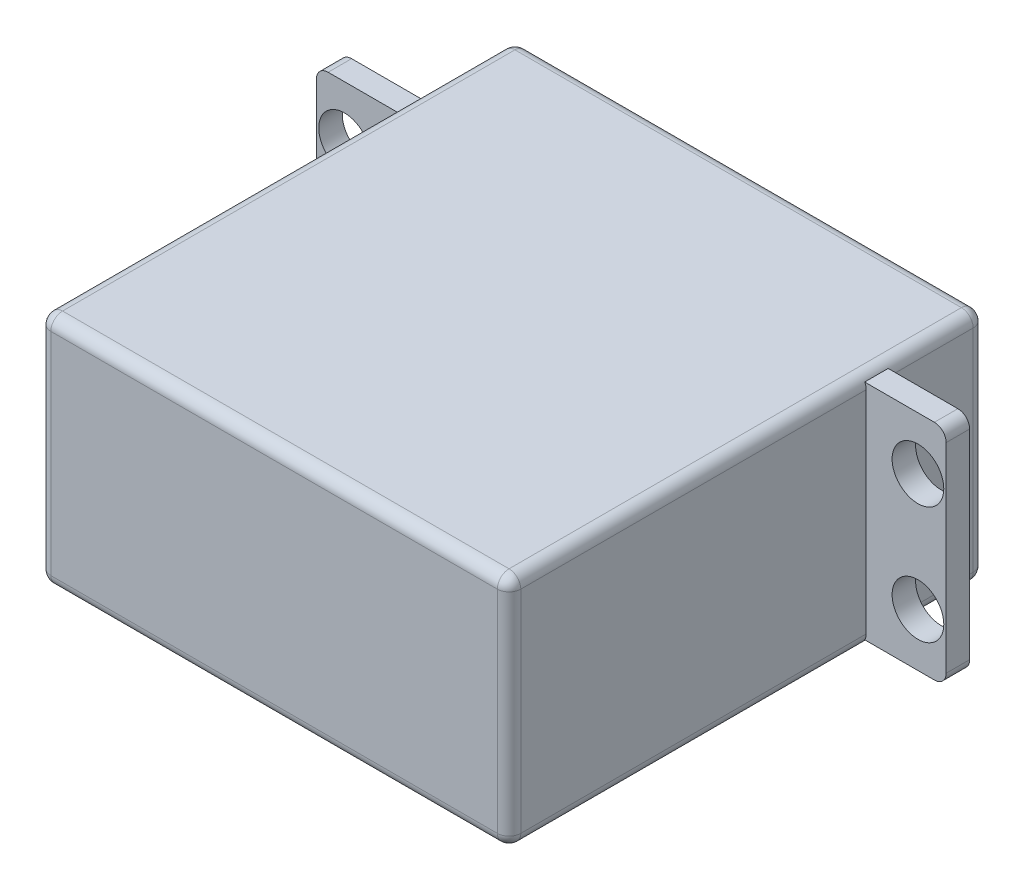
from build123d import *

# Parameters (mm, degrees)
SKETCH1_W           = 40
SKETCH1_H           = 20
BOSS_EXTRUDE1_DEPTH = 40.5
SKETCH2_W           = 53.6
SKETCH2_H           = 19
BOSS_EXTRUDE2_DEPTH = 2
SKETCH3_R           = 2.2
CUT_EXTRUDE1_DEPTH  = 2
SKETCH4_R           = 3
SKETCH4_R_2         = 1
BOSS_EXTRUDE3_DEPTH = 4
FILLET1_R           = 1
FILLET2_R           = 1


with BuildPart() as part:
    # Sketch1 → Boss-Extrude1 (new body)
    with BuildSketch(Plane.XY):
        Rectangle(SKETCH1_W, SKETCH1_H)
    extrude(amount=BOSS_EXTRUDE1_DEPTH)

    # Sketch2 → Boss-Extrude2 (add)
    with BuildSketch(Plane.XY.offset(10.1)):
        Rectangle(SKETCH2_W, SKETCH2_H)
    extrude(amount=-BOSS_EXTRUDE2_DEPTH)

    # Sketch3 → Cut-Extrude1 (cut)
    with BuildSketch(Plane.XY.offset(10.1)):
        with Locations((-24.4, 5)):
            Circle(SKETCH3_R)
        with Locations((-24.4, -5)):
            Circle(SKETCH3_R)
        with Locations((24.4, 5)):
            Circle(SKETCH3_R)
        with Locations((24.4, -5)):
            Circle(SKETCH3_R)
    extrude(amount=-CUT_EXTRUDE1_DEPTH, mode=Mode.SUBTRACT)

    # Sketch4 → Boss-Extrude3 (add)
    with BuildSketch(Plane(origin=(0, 0, 0), x_dir=(-1, 0, 0), z_dir=(0, 0, -1))):
        with Locations((10, 0)):
            Circle(SKETCH4_R)
        with Locations((10, 0)):
            Circle(SKETCH4_R_2, mode=Mode.SUBTRACT)
    extrude(amount=BOSS_EXTRUDE3_DEPTH)

    # Fillet1
    # the kernel refuses this fillet: 1 mm, written as the material it takes off along each edge
    with BuildSketch(Plane(origin=(-26.8, -9.5, 12.6), x_dir=(1, 0, 0), z_dir=(0, 0, -1)), Plane(origin=(26.8, 9.5, 12.6), x_dir=(-1, 0, 0), z_dir=(0, 0, -1))) as fillet1_piece_1:
        with BuildLine():
            CenterArc((FILLET1_R, -FILLET1_R), FILLET1_R, 90, 90)
            Line((0, -FILLET1_R), (0, 0))
            Line((0, 0), (FILLET1_R, 0))
        make_face()
    extrude(amount=7, mode=Mode.SUBTRACT)
    with BuildSketch(Plane(origin=(-26.8, 9.5, 12.6), x_dir=(1, 0, 0), z_dir=(0, 0, -1)), Plane(origin=(26.8, -9.5, 12.6), x_dir=(-1, 0, 0), z_dir=(0, 0, -1))) as fillet1_piece_2:
        with BuildLine():
            CenterArc((FILLET1_R, FILLET1_R), FILLET1_R, 180, 90)
            Line((0, FILLET1_R), (0, 0))
            Line((0, 0), (FILLET1_R, 0))
        make_face()
    extrude(amount=7, mode=Mode.SUBTRACT)
    with BuildSketch(Plane(origin=(-20, 10, -2.5), x_dir=(0, -1, 0), z_dir=(0, 0, 1))) as fillet1_piece_3_section:
        with BuildLine():
            CenterArc((FILLET1_R, FILLET1_R), FILLET1_R, 180, 90)
            Line((0, FILLET1_R), (0, 0))
            Line((0, 0), (FILLET1_R, 0))
        make_face()
    fillet1_piece_3 = extrude(amount=45.5, mode=Mode.PRIVATE)
    fillet1_piece_3 = split(fillet1_piece_3, bisect_by=Plane(origin=(-19.975991618, 9.336749215, 8.1), z_dir=(0, 0, -1)), keep=Keep.TOP, mode=Mode.PRIVATE)
    fillet1_piece_3 = split(fillet1_piece_3, bisect_by=Plane(origin=(-19.975991618, 9.5, 2.8), z_dir=(0, -1, 0)), keep=Keep.TOP, mode=Mode.PRIVATE)
    add(fillet1_piece_3, mode=Mode.SUBTRACT)
    with BuildSketch(Plane(origin=(-20, 10, -2.5), x_dir=(0, -1, 0), z_dir=(0, 0, 1))) as fillet1_piece_4_section:
        with BuildLine():
            CenterArc((FILLET1_R, FILLET1_R), FILLET1_R, 180, 90)
            Line((0, FILLET1_R), (0, 0))
            Line((0, 0), (FILLET1_R, 0))
        make_face()
    fillet1_piece_4 = extrude(amount=45.5, mode=Mode.PRIVATE)
    fillet1_piece_4 = split(fillet1_piece_4, bisect_by=Plane(origin=(-19.74487994, 9.835608236, 8.1), z_dir=(0, 0, -1)), keep=Keep.TOP, mode=Mode.PRIVATE)
    fillet1_piece_4 = split(fillet1_piece_4, bisect_by=Plane(origin=(-19.74487994, 9.5, 2.8), z_dir=(0, 1, 0)), keep=Keep.TOP, mode=Mode.PRIVATE)
    add(fillet1_piece_4, mode=Mode.SUBTRACT)
    with BuildSketch(Plane(origin=(-20, 10, -2.5), x_dir=(0, -1, 0), z_dir=(0, 0, 1))) as fillet1_piece_5_section:
        with BuildLine():
            CenterArc((FILLET1_R, FILLET1_R), FILLET1_R, 180, 90)
            Line((0, FILLET1_R), (0, 0))
            Line((0, 0), (FILLET1_R, 0))
        make_face()
    fillet1_piece_5 = extrude(amount=45.5, mode=Mode.PRIVATE)
    fillet1_piece_5 = split(fillet1_piece_5, bisect_by=Plane(origin=(-19.74487994, 9.835608236, 8.1), z_dir=(0, 0, 1)), keep=Keep.TOP, mode=Mode.PRIVATE)
    fillet1_piece_5 = split(fillet1_piece_5, bisect_by=Plane(origin=(-19.74487994, 9.5, 9.1), z_dir=(0, 1, 0)), keep=Keep.TOP, mode=Mode.PRIVATE)
    fillet1_piece_5 = split(fillet1_piece_5, bisect_by=Plane(origin=(-19.74487994, 9.835608236, 10.1), z_dir=(0, 0, -1)), keep=Keep.TOP, mode=Mode.PRIVATE)
    add(fillet1_piece_5, mode=Mode.SUBTRACT)
    with BuildSketch(Plane(origin=(-20, 10, -2.5), x_dir=(0, -1, 0), z_dir=(0, 0, 1))) as fillet1_piece_6_section:
        with BuildLine():
            CenterArc((FILLET1_R, FILLET1_R), FILLET1_R, 180, 90)
            Line((0, FILLET1_R), (0, 0))
            Line((0, 0), (FILLET1_R, 0))
        make_face()
    fillet1_piece_6 = extrude(amount=45.5, mode=Mode.PRIVATE)
    fillet1_piece_6 = split(fillet1_piece_6, bisect_by=Plane(origin=(-19.975991618, 9.5, 26.55), z_dir=(0, -1, 0)), keep=Keep.TOP, mode=Mode.PRIVATE)
    fillet1_piece_6 = split(fillet1_piece_6, bisect_by=Plane(origin=(-19.975991618, 9.336749215, 10.1), z_dir=(0, 0, 1)), keep=Keep.TOP, mode=Mode.PRIVATE)
    add(fillet1_piece_6, mode=Mode.SUBTRACT)
    with BuildSketch(Plane(origin=(-20, 10, -2.5), x_dir=(0, -1, 0), z_dir=(0, 0, 1))) as fillet1_piece_7_section:
        with BuildLine():
            CenterArc((FILLET1_R, FILLET1_R), FILLET1_R, 180, 90)
            Line((0, FILLET1_R), (0, 0))
            Line((0, 0), (FILLET1_R, 0))
        make_face()
    fillet1_piece_7 = extrude(amount=45.5, mode=Mode.PRIVATE)
    fillet1_piece_7 = split(fillet1_piece_7, bisect_by=Plane(origin=(-19.74487994, 9.5, 26.55), z_dir=(0, 1, 0)), keep=Keep.TOP, mode=Mode.PRIVATE)
    fillet1_piece_7 = split(fillet1_piece_7, bisect_by=Plane(origin=(-19.74487994, 9.835608236, 10.1), z_dir=(0, 0, 1)), keep=Keep.TOP, mode=Mode.PRIVATE)
    add(fillet1_piece_7, mode=Mode.SUBTRACT)
    with BuildSketch(Plane(origin=(20, 10, -2.5), x_dir=(0, -1, 0), z_dir=(0, 0, 1))) as fillet1_piece_8_section:
        with BuildLine():
            CenterArc((FILLET1_R, -FILLET1_R), FILLET1_R, 90, 90)
            Line((0, -FILLET1_R), (0, 0))
            Line((0, 0), (FILLET1_R, 0))
        make_face()
    fillet1_piece_8 = extrude(amount=45.5, mode=Mode.PRIVATE)
    fillet1_piece_8 = split(fillet1_piece_8, bisect_by=Plane(origin=(19.975991618, 9.5, 2.8), z_dir=(0, -1, 0)), keep=Keep.TOP, mode=Mode.PRIVATE)
    fillet1_piece_8 = split(fillet1_piece_8, bisect_by=Plane(origin=(19.975991618, 9.336749215, 8.1), z_dir=(0, 0, -1)), keep=Keep.TOP, mode=Mode.PRIVATE)
    add(fillet1_piece_8, mode=Mode.SUBTRACT)
    with BuildSketch(Plane(origin=(20, 10, -2.5), x_dir=(0, -1, 0), z_dir=(0, 0, 1))) as fillet1_piece_9_section:
        with BuildLine():
            CenterArc((FILLET1_R, -FILLET1_R), FILLET1_R, 90, 90)
            Line((0, -FILLET1_R), (0, 0))
            Line((0, 0), (FILLET1_R, 0))
        make_face()
    fillet1_piece_9 = extrude(amount=45.5, mode=Mode.PRIVATE)
    fillet1_piece_9 = split(fillet1_piece_9, bisect_by=Plane(origin=(19.74487994, 9.5, 2.8), z_dir=(0, 1, 0)), keep=Keep.TOP, mode=Mode.PRIVATE)
    fillet1_piece_9 = split(fillet1_piece_9, bisect_by=Plane(origin=(19.74487994, 9.835608236, 8.1), z_dir=(0, 0, -1)), keep=Keep.TOP, mode=Mode.PRIVATE)
    add(fillet1_piece_9, mode=Mode.SUBTRACT)
    with BuildSketch(Plane(origin=(20, 10, -2.5), x_dir=(0, -1, 0), z_dir=(0, 0, 1))) as fillet1_piece_10_section:
        with BuildLine():
            CenterArc((FILLET1_R, -FILLET1_R), FILLET1_R, 90, 90)
            Line((0, -FILLET1_R), (0, 0))
            Line((0, 0), (FILLET1_R, 0))
        make_face()
    fillet1_piece_10 = extrude(amount=45.5, mode=Mode.PRIVATE)
    fillet1_piece_10 = split(fillet1_piece_10, bisect_by=Plane(origin=(19.74487994, 9.835608236, 10.1), z_dir=(0, 0, -1)), keep=Keep.TOP, mode=Mode.PRIVATE)
    fillet1_piece_10 = split(fillet1_piece_10, bisect_by=Plane(origin=(19.74487994, 9.5, 9.1), z_dir=(0, 1, 0)), keep=Keep.TOP, mode=Mode.PRIVATE)
    fillet1_piece_10 = split(fillet1_piece_10, bisect_by=Plane(origin=(19.74487994, 9.835608236, 8.1), z_dir=(0, 0, 1)), keep=Keep.TOP, mode=Mode.PRIVATE)
    add(fillet1_piece_10, mode=Mode.SUBTRACT)
    with BuildSketch(Plane(origin=(20, 10, -2.5), x_dir=(0, -1, 0), z_dir=(0, 0, 1))) as fillet1_piece_11_section:
        with BuildLine():
            CenterArc((FILLET1_R, -FILLET1_R), FILLET1_R, 90, 90)
            Line((0, -FILLET1_R), (0, 0))
            Line((0, 0), (FILLET1_R, 0))
        make_face()
    fillet1_piece_11 = extrude(amount=45.5, mode=Mode.PRIVATE)
    fillet1_piece_11 = split(fillet1_piece_11, bisect_by=Plane(origin=(19.975991618, 9.336749215, 10.1), z_dir=(0, 0, 1)), keep=Keep.TOP, mode=Mode.PRIVATE)
    fillet1_piece_11 = split(fillet1_piece_11, bisect_by=Plane(origin=(19.975991618, 9.5, 26.55), z_dir=(0, -1, 0)), keep=Keep.TOP, mode=Mode.PRIVATE)
    add(fillet1_piece_11, mode=Mode.SUBTRACT)
    with BuildSketch(Plane(origin=(20, 10, -2.5), x_dir=(0, -1, 0), z_dir=(0, 0, 1))) as fillet1_piece_12_section:
        with BuildLine():
            CenterArc((FILLET1_R, -FILLET1_R), FILLET1_R, 90, 90)
            Line((0, -FILLET1_R), (0, 0))
            Line((0, 0), (FILLET1_R, 0))
        make_face()
    fillet1_piece_12 = extrude(amount=45.5, mode=Mode.PRIVATE)
    fillet1_piece_12 = split(fillet1_piece_12, bisect_by=Plane(origin=(19.74487994, 9.835608236, 10.1), z_dir=(0, 0, 1)), keep=Keep.TOP, mode=Mode.PRIVATE)
    fillet1_piece_12 = split(fillet1_piece_12, bisect_by=Plane(origin=(19.74487994, 9.5, 26.55), z_dir=(0, 1, 0)), keep=Keep.TOP, mode=Mode.PRIVATE)
    add(fillet1_piece_12, mode=Mode.SUBTRACT)
    with BuildSketch(Plane(origin=(-20, -10, -2.5), x_dir=(1, 0, 0), z_dir=(0, 0, 1))) as fillet1_piece_13_section:
        with BuildLine():
            CenterArc((FILLET1_R, FILLET1_R), FILLET1_R, 180, 90)
            Line((0, FILLET1_R), (0, 0))
            Line((0, 0), (FILLET1_R, 0))
        make_face()
    fillet1_piece_13 = extrude(amount=45.5, mode=Mode.PRIVATE)
    fillet1_piece_13 = split(fillet1_piece_13, bisect_by=Plane(origin=(-19.74487994, -9.835608236, 8.1), z_dir=(0, 0, -1)), keep=Keep.TOP, mode=Mode.PRIVATE)
    fillet1_piece_13 = split(fillet1_piece_13, bisect_by=Plane(origin=(-19.74487994, -9.5, 2.8), z_dir=(0, -1, 0)), keep=Keep.TOP, mode=Mode.PRIVATE)
    add(fillet1_piece_13, mode=Mode.SUBTRACT)
    with BuildSketch(Plane(origin=(-20, -10, -2.5), x_dir=(1, 0, 0), z_dir=(0, 0, 1))) as fillet1_piece_14_section:
        with BuildLine():
            CenterArc((FILLET1_R, FILLET1_R), FILLET1_R, 180, 90)
            Line((0, FILLET1_R), (0, 0))
            Line((0, 0), (FILLET1_R, 0))
        make_face()
    fillet1_piece_14 = extrude(amount=45.5, mode=Mode.PRIVATE)
    fillet1_piece_14 = split(fillet1_piece_14, bisect_by=Plane(origin=(-19.975991618, -9.336749215, 8.1), z_dir=(0, 0, -1)), keep=Keep.TOP, mode=Mode.PRIVATE)
    fillet1_piece_14 = split(fillet1_piece_14, bisect_by=Plane(origin=(-19.975991618, -9.5, 2.8), z_dir=(0, 1, 0)), keep=Keep.TOP, mode=Mode.PRIVATE)
    add(fillet1_piece_14, mode=Mode.SUBTRACT)
    with BuildSketch(Plane(origin=(-20, -10, -2.5), x_dir=(1, 0, 0), z_dir=(0, 0, 1))) as fillet1_piece_15_section:
        with BuildLine():
            CenterArc((FILLET1_R, FILLET1_R), FILLET1_R, 180, 90)
            Line((0, FILLET1_R), (0, 0))
            Line((0, 0), (FILLET1_R, 0))
        make_face()
    fillet1_piece_15 = extrude(amount=45.5, mode=Mode.PRIVATE)
    fillet1_piece_15 = split(fillet1_piece_15, bisect_by=Plane(origin=(-19.74487994, -9.835608236, 8.1), z_dir=(0, 0, 1)), keep=Keep.TOP, mode=Mode.PRIVATE)
    fillet1_piece_15 = split(fillet1_piece_15, bisect_by=Plane(origin=(-19.74487994, -9.835608236, 10.1), z_dir=(0, 0, -1)), keep=Keep.TOP, mode=Mode.PRIVATE)
    fillet1_piece_15 = split(fillet1_piece_15, bisect_by=Plane(origin=(-19.74487994, -9.5, 9.1), z_dir=(0, -1, 0)), keep=Keep.TOP, mode=Mode.PRIVATE)
    add(fillet1_piece_15, mode=Mode.SUBTRACT)
    with BuildSketch(Plane(origin=(-20, -10, -2.5), x_dir=(1, 0, 0), z_dir=(0, 0, 1))) as fillet1_piece_16_section:
        with BuildLine():
            CenterArc((FILLET1_R, FILLET1_R), FILLET1_R, 180, 90)
            Line((0, FILLET1_R), (0, 0))
            Line((0, 0), (FILLET1_R, 0))
        make_face()
    fillet1_piece_16 = extrude(amount=45.5, mode=Mode.PRIVATE)
    fillet1_piece_16 = split(fillet1_piece_16, bisect_by=Plane(origin=(-19.74487994, -9.835608236, 10.1), z_dir=(0, 0, 1)), keep=Keep.TOP, mode=Mode.PRIVATE)
    fillet1_piece_16 = split(fillet1_piece_16, bisect_by=Plane(origin=(-19.74487994, -9.5, 26.55), z_dir=(0, -1, 0)), keep=Keep.TOP, mode=Mode.PRIVATE)
    add(fillet1_piece_16, mode=Mode.SUBTRACT)
    with BuildSketch(Plane(origin=(-20, -10, -2.5), x_dir=(1, 0, 0), z_dir=(0, 0, 1))) as fillet1_piece_17_section:
        with BuildLine():
            CenterArc((FILLET1_R, FILLET1_R), FILLET1_R, 180, 90)
            Line((0, FILLET1_R), (0, 0))
            Line((0, 0), (FILLET1_R, 0))
        make_face()
    fillet1_piece_17 = extrude(amount=45.5, mode=Mode.PRIVATE)
    fillet1_piece_17 = split(fillet1_piece_17, bisect_by=Plane(origin=(-19.975991618, -9.336749215, 10.1), z_dir=(0, 0, 1)), keep=Keep.TOP, mode=Mode.PRIVATE)
    fillet1_piece_17 = split(fillet1_piece_17, bisect_by=Plane(origin=(-19.975991618, -9.5, 26.55), z_dir=(0, 1, 0)), keep=Keep.TOP, mode=Mode.PRIVATE)
    add(fillet1_piece_17, mode=Mode.SUBTRACT)
    with BuildSketch(Plane(origin=(20, -10, -2.5), x_dir=(-1, 0, 0), z_dir=(0, 0, 1))) as fillet1_piece_18_section:
        with BuildLine():
            CenterArc((FILLET1_R, -FILLET1_R), FILLET1_R, 90, 90)
            Line((0, -FILLET1_R), (0, 0))
            Line((0, 0), (FILLET1_R, 0))
        make_face()
    fillet1_piece_18 = extrude(amount=45.5, mode=Mode.PRIVATE)
    fillet1_piece_18 = split(fillet1_piece_18, bisect_by=Plane(origin=(19.74487994, -9.835608236, 8.1), z_dir=(0, 0, -1)), keep=Keep.TOP, mode=Mode.PRIVATE)
    fillet1_piece_18 = split(fillet1_piece_18, bisect_by=Plane(origin=(19.74487994, -9.5, 2.8), z_dir=(0, -1, 0)), keep=Keep.TOP, mode=Mode.PRIVATE)
    add(fillet1_piece_18, mode=Mode.SUBTRACT)
    with BuildSketch(Plane(origin=(20, -10, -2.5), x_dir=(-1, 0, 0), z_dir=(0, 0, 1))) as fillet1_piece_19_section:
        with BuildLine():
            CenterArc((FILLET1_R, -FILLET1_R), FILLET1_R, 90, 90)
            Line((0, -FILLET1_R), (0, 0))
            Line((0, 0), (FILLET1_R, 0))
        make_face()
    fillet1_piece_19 = extrude(amount=45.5, mode=Mode.PRIVATE)
    fillet1_piece_19 = split(fillet1_piece_19, bisect_by=Plane(origin=(19.975991618, -9.336749215, 8.1), z_dir=(0, 0, -1)), keep=Keep.TOP, mode=Mode.PRIVATE)
    fillet1_piece_19 = split(fillet1_piece_19, bisect_by=Plane(origin=(19.975991618, -9.5, 2.8), z_dir=(0, 1, 0)), keep=Keep.TOP, mode=Mode.PRIVATE)
    add(fillet1_piece_19, mode=Mode.SUBTRACT)
    with BuildSketch(Plane(origin=(20, -10, -2.5), x_dir=(-1, 0, 0), z_dir=(0, 0, 1))) as fillet1_piece_20_section:
        with BuildLine():
            CenterArc((FILLET1_R, -FILLET1_R), FILLET1_R, 90, 90)
            Line((0, -FILLET1_R), (0, 0))
            Line((0, 0), (FILLET1_R, 0))
        make_face()
    fillet1_piece_20 = extrude(amount=45.5, mode=Mode.PRIVATE)
    fillet1_piece_20 = split(fillet1_piece_20, bisect_by=Plane(origin=(19.74487994, -9.835608236, 10.1), z_dir=(0, 0, -1)), keep=Keep.TOP, mode=Mode.PRIVATE)
    fillet1_piece_20 = split(fillet1_piece_20, bisect_by=Plane(origin=(19.74487994, -9.835608236, 8.1), z_dir=(0, 0, 1)), keep=Keep.TOP, mode=Mode.PRIVATE)
    fillet1_piece_20 = split(fillet1_piece_20, bisect_by=Plane(origin=(19.74487994, -9.5, 9.1), z_dir=(0, -1, 0)), keep=Keep.TOP, mode=Mode.PRIVATE)
    add(fillet1_piece_20, mode=Mode.SUBTRACT)
    with BuildSketch(Plane(origin=(20, -10, -2.5), x_dir=(-1, 0, 0), z_dir=(0, 0, 1))) as fillet1_piece_21_section:
        with BuildLine():
            CenterArc((FILLET1_R, -FILLET1_R), FILLET1_R, 90, 90)
            Line((0, -FILLET1_R), (0, 0))
            Line((0, 0), (FILLET1_R, 0))
        make_face()
    fillet1_piece_21 = extrude(amount=45.5, mode=Mode.PRIVATE)
    fillet1_piece_21 = split(fillet1_piece_21, bisect_by=Plane(origin=(19.74487994, -9.835608236, 10.1), z_dir=(0, 0, 1)), keep=Keep.TOP, mode=Mode.PRIVATE)
    fillet1_piece_21 = split(fillet1_piece_21, bisect_by=Plane(origin=(19.74487994, -9.5, 26.55), z_dir=(0, -1, 0)), keep=Keep.TOP, mode=Mode.PRIVATE)
    add(fillet1_piece_21, mode=Mode.SUBTRACT)
    with BuildSketch(Plane(origin=(20, -10, -2.5), x_dir=(-1, 0, 0), z_dir=(0, 0, 1))) as fillet1_piece_22_section:
        with BuildLine():
            CenterArc((FILLET1_R, -FILLET1_R), FILLET1_R, 90, 90)
            Line((0, -FILLET1_R), (0, 0))
            Line((0, 0), (FILLET1_R, 0))
        make_face()
    fillet1_piece_22 = extrude(amount=45.5, mode=Mode.PRIVATE)
    fillet1_piece_22 = split(fillet1_piece_22, bisect_by=Plane(origin=(19.975991618, -9.336749215, 10.1), z_dir=(0, 0, 1)), keep=Keep.TOP, mode=Mode.PRIVATE)
    fillet1_piece_22 = split(fillet1_piece_22, bisect_by=Plane(origin=(19.975991618, -9.5, 26.55), z_dir=(0, 1, 0)), keep=Keep.TOP, mode=Mode.PRIVATE)
    add(fillet1_piece_22, mode=Mode.SUBTRACT)

    # Fillet2
    fillet2_edges = [part.edges().sort_by_distance(p)[0] for p in [
        (-20, 0, 0),
        (-20, 0, 40.5),
        (20, 0, 0),
        (0, -10, 0),
        (0, 10, 0),
        (19.707106781, -9.707106781, 0),
        (-19.707106781, -9.707106781, 0),
        (19.707106781, 9.707106781, 0),
        (-19.707106781, 9.707106781, 0),
        (0, 10, 40.5),
        (20, 0, 40.5),
        (0, -10, 40.5),
        (19.707106781, -9.707106781, 40.5),
        (-19.707106781, -9.707106781, 40.5),
        (19.707106781, 9.707106781, 40.5),
        (-19.707106781, 9.707106781, 40.5),
    ]]
    fillet(fillet2_edges, radius=FILLET2_R)


solid = part.part
